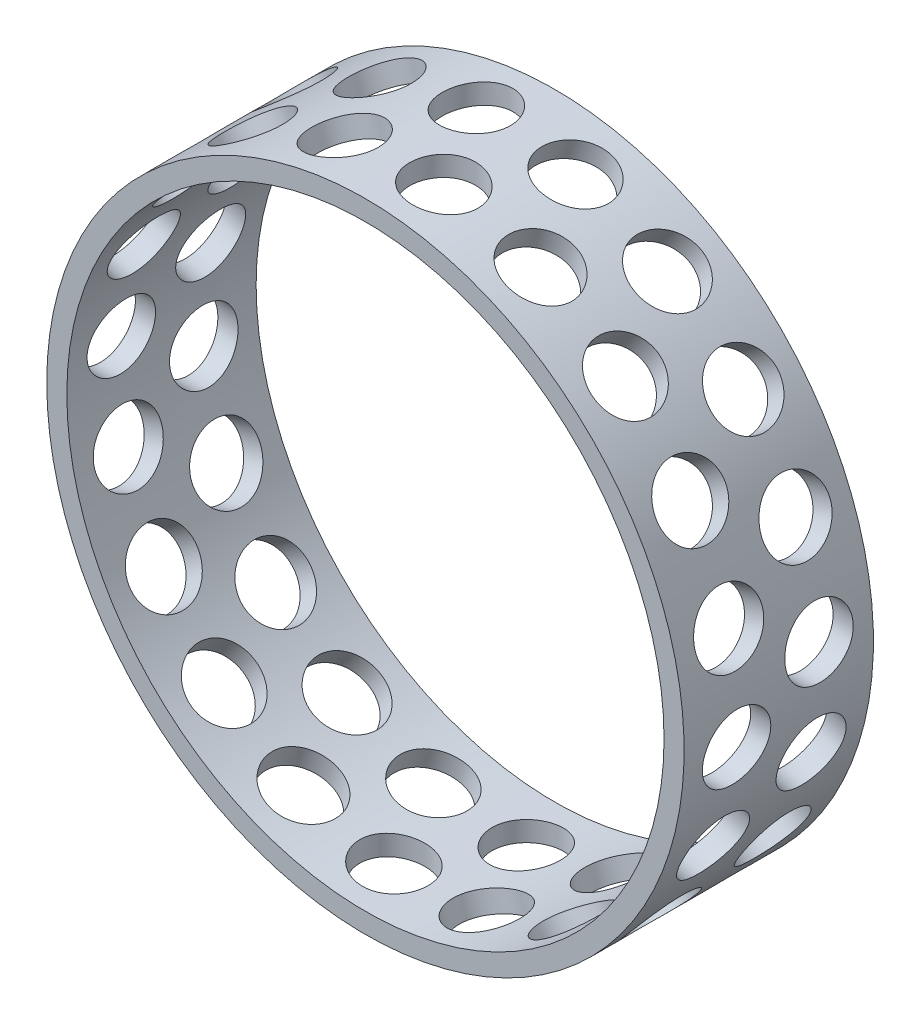
from build123d import *

# Parameters (mm, degrees)
SKETCH1_W          = 47.15
SKETCH1_H          = 5
SKETCH2_R          = 8.5
CUT_EXTRUDE1_DEPTH = 123.144192453
CIRPATTERN1_COUNT  = 20


with BuildPart() as part:
    # Sketch1 → Revolve1 (revolve)
    with BuildSketch(Plane(origin=(0, 0, 0), x_dir=(0, 0, -1), z_dir=(1, 0, 0))):
        with Locations((24.575, 76.875)):
            Rectangle(SKETCH1_W, SKETCH1_H)
    revolve(axis=Axis((0, 0, -50.5075), (0, 0, 1)))

    # Sketch2 → Cut-Extrude1 (cut, through all)
    with BuildSketch(Plane(origin=(0, 0, 0), x_dir=(0, 0, -1), z_dir=(1, 0, 0))):
        with Locations((14.309765987, 6.214899086)):
            Circle(SKETCH2_R)
        with Locations((34.840234013, -6.214899086)):
            Circle(SKETCH2_R)
    cut_extrude1 = extrude(amount=-CUT_EXTRUDE1_DEPTH, mode=Mode.SUBTRACT)

    # CirPattern1: Cut-Extrude1 ×20 about axis
    cirpattern1_axis = Axis((0, 0, -50.5075), (0, 0, 1))
    for i in range(1, CIRPATTERN1_COUNT):
        add(cut_extrude1.rotate(cirpattern1_axis, i * 360 / CIRPATTERN1_COUNT), mode=Mode.SUBTRACT)


solid = part.part
